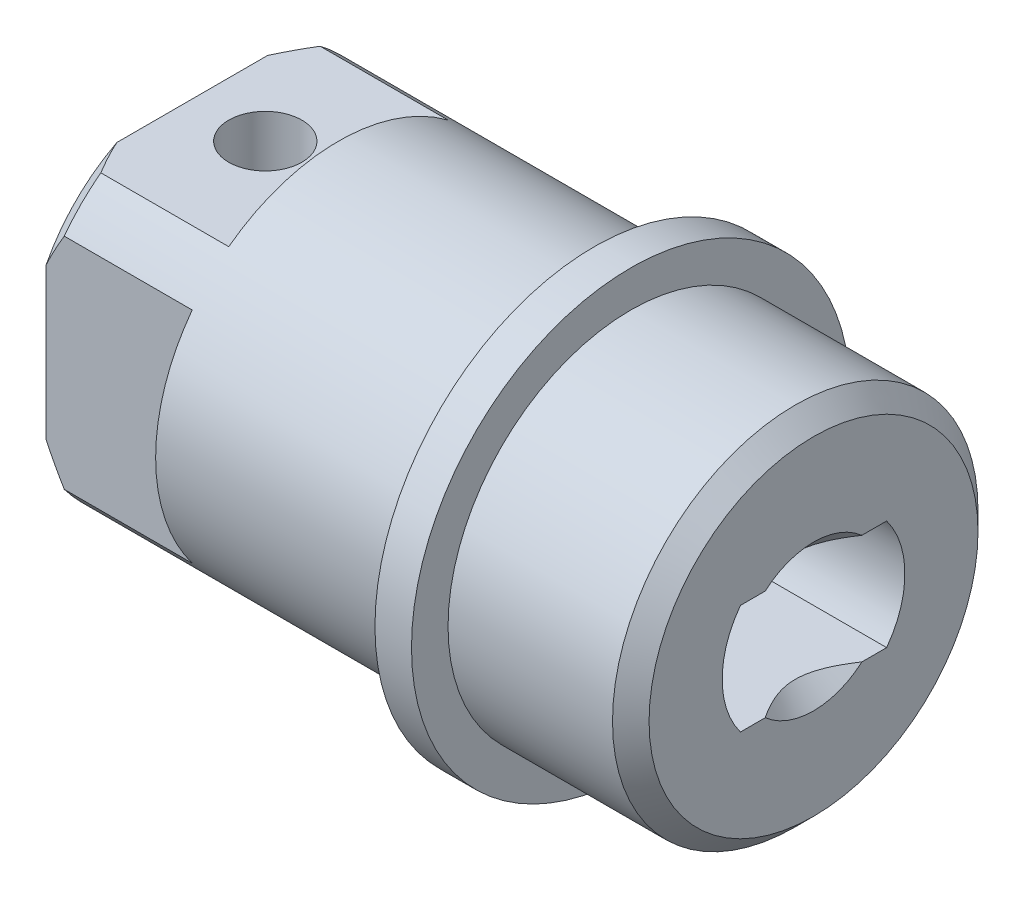
from build123d import *

# Parameters (mm, degrees)
CHAMFER_1_SIZE       = 0.5
SKETCH_2_OUTSIDE_W   = 18.804
SKETCH_2_OUTSIDE_H   = 18.804
SKETCH_2_OUTSIDE_W_2 = 8
SKETCH_2_OUTSIDE_H_2 = 8
CUT_EXTRUDE_1_DEPTH  = 4
SKETCH_3_R           = 1
CUT_EXTRUDE_2_DEPTH  = 12
CUT_EXTRUDE_3_DEPTH  = 10


with BuildPart() as part:
    # 草图1 → 旋转1 (revolve)
    with BuildSketch(Plane.XY):
        Polygon((0, 0), (0, 5), (11, 5), (11, 6), (12, 6), (12, 5), (17, 5), (17, 1.5), (7, 1.5), (6.133974596, 0), align=None)
    revolve(axis=Axis((0, 0, 0), (1, 0, 0)))

    # 倒角1
    chamfer_1_edges = [part.edges().sort_by_distance(p)[0] for p in [
        (17, -1.5, 0),
        (17, -5, 0),
        (0, -5, 0),
    ]]
    chamfer(chamfer_1_edges, length=CHAMFER_1_SIZE)

    # 草图2 outside → 切除-拉伸1 (cut)
    with BuildSketch(Plane.ZY):
        Rectangle(SKETCH_2_OUTSIDE_W, SKETCH_2_OUTSIDE_H)
        Rectangle(SKETCH_2_OUTSIDE_W_2, SKETCH_2_OUTSIDE_H_2, mode=Mode.SUBTRACT)
    extrude(amount=-CUT_EXTRUDE_1_DEPTH, mode=Mode.SUBTRACT)

    # 草图3 → 切除-拉伸2 (cut, symmetric)
    with BuildSketch(Plane(origin=(0, 0, 0), x_dir=(1, 0, 0), z_dir=(0, 1, 0))):
        with Locations((2, 0)):
            Circle(SKETCH_3_R)
    extrude(amount=CUT_EXTRUDE_2_DEPTH, both=True, mode=Mode.SUBTRACT)

    # 草图4 → 切除-拉伸3 (cut)
    with BuildSketch(Plane(origin=(17, 0, 0), x_dir=(0, 0, -1), z_dir=(1, 0, 0))):
        with BuildLine():
            Line((-2, 1.5), (2, 1.5))
            ThreePointArc((2, 1.5), (2.5, 0), (2, -1.5))
            Line((2, -1.5), (-2, -1.5))
            ThreePointArc((-2, -1.5), (-2.5, 0), (-2, 1.5))
        make_face()
    extrude(amount=-CUT_EXTRUDE_3_DEPTH, mode=Mode.SUBTRACT)


solid = part.part
